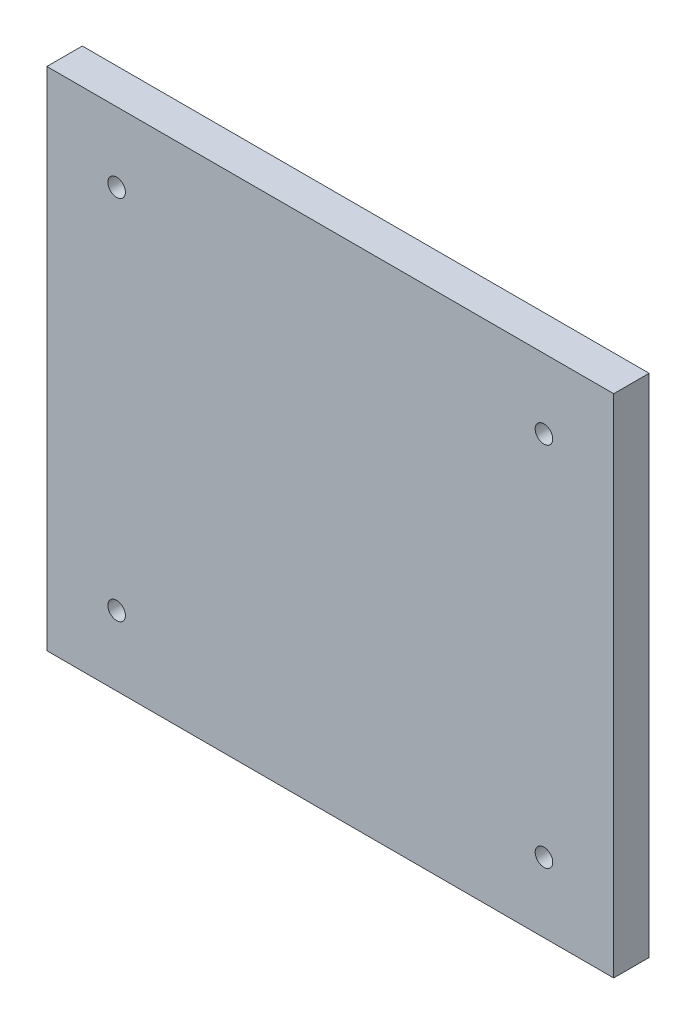
from build123d import *

# Parameters (mm, degrees)
PROFILE_SKETCH_W        = 101.6
PROFILE_SKETCH_H        = 90.7
PROFILE_EXTRUDE_DEPTH   = 6.35
MOUNTING_HOLE_SKETCH_R  = 1.575
MOUNTING_HOLE_CUT_DEPTH = 69.392872436


with BuildPart() as part:
    # Profile Sketch → Profile Extrude (new body)
    with BuildSketch(Plane.XY):
        Rectangle(PROFILE_SKETCH_W, PROFILE_SKETCH_H)
    extrude(amount=PROFILE_EXTRUDE_DEPTH)

    # Mounting Hole Sketch → Mounting Hole Cut (cut, through all)
    with BuildSketch(Plane.XY.offset(6.35)):
        with Locations((-38.3, 32.85)):
            Circle(MOUNTING_HOLE_SKETCH_R)
        with Locations((38.3, 32.85)):
            Circle(MOUNTING_HOLE_SKETCH_R)
        with Locations((38.3, -32.85)):
            Circle(MOUNTING_HOLE_SKETCH_R)
        with Locations((-38.3, -32.85)):
            Circle(MOUNTING_HOLE_SKETCH_R)
    extrude(amount=-MOUNTING_HOLE_CUT_DEPTH, mode=Mode.SUBTRACT)


solid = part.part
